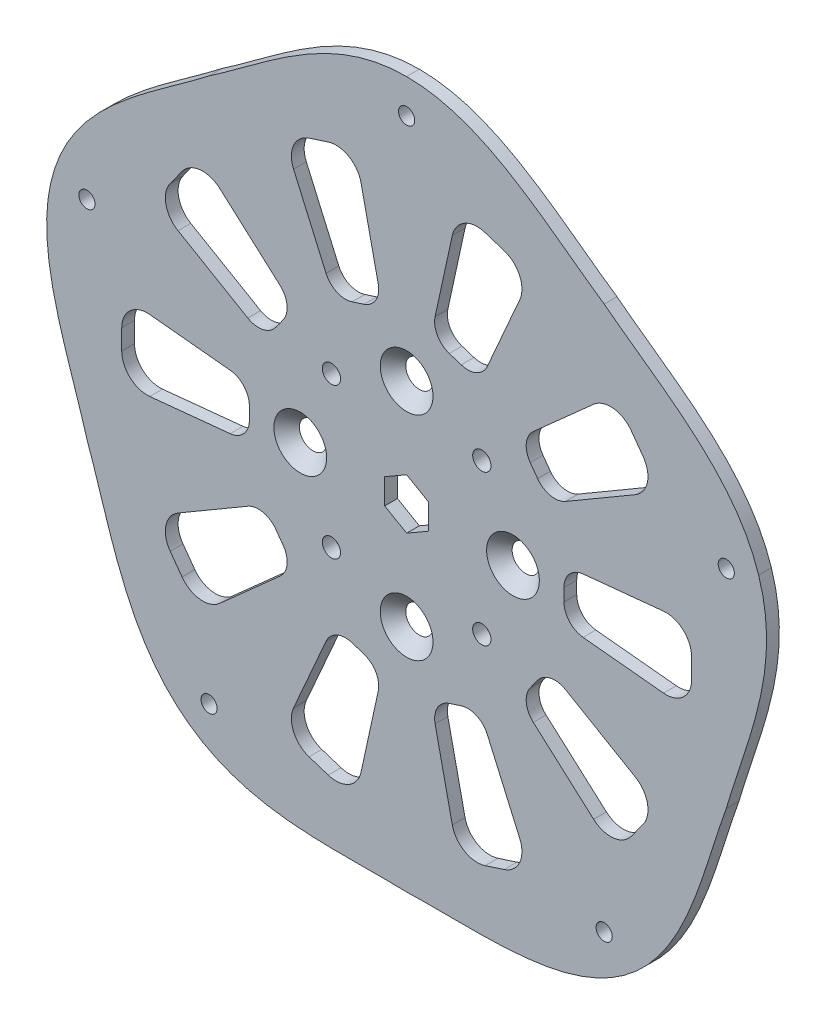
from build123d import *

# Parameters (mm, degrees)
SZKIC1_R                    = 3.3
SZKIC1_R_2                  = 3.2
SZKIC1_R_3                  = 1.9
DODANIE_WYCI_GNI_CIE1_DEPTH = 3
SKETCH1_R                   = 2.15
CUT_EXTRUDE1_DEPTH          = 7
CHAMFER1_SIZE               = 3
CUT_EXTRUDE2_DEPTH          = 5.5


with BuildPart() as part:
    # Szkic1 → Dodanie-wyciągnięcie1 (new body)
    with BuildSketch(Plane.XY):
        with BuildLine():
            add(Edge.make_bspline(
                [(0, 87), (18.224844976, 86.998612649), (32.288902875, 73.536902698), (46.435034931, 63.912342556)],
                knots=[0, 0, 0, 0, 1, 1, 1, 1], degree=3))
            add(Edge.make_bspline(
                [(82.741916918, 26.884478511), (77.108810651, 44.216907368), (59.959930782, 53.43272413), (46.435034931, 63.912342556)],
                knots=[0, 0, 0, 0, 1, 1, 1, 1], degree=3))
            add(Edge.make_bspline(
                [(82.741916918, 26.884478511), (88.372384286, 9.551192223), (79.915570217, -7.984418835), (75.133464787, -24.412342556)],
                knots=[0, 0, 0, 0, 1, 1, 1, 1], degree=3))
            add(Edge.make_bspline(
                [(51.137316949, -70.384478511), (65.88071079, -59.671061018), (69.346178061, -40.513663074), (75.133464787, -24.412342556)],
                knots=[0, 0, 0, 0, 1, 1, 1, 1], degree=3))
            add(Edge.make_bspline(
                [(51.137316949, -70.384478511), (36.39229218, -81.095651222), (17.10163575, -78.471544919), (0, -79)],
                knots=[0, 0, 0, 0, 1, 1, 1, 1], degree=3))
            add(Edge.make_bspline(
                [(-51.137316949, -70.384478511), (-36.39229218, -81.095651222), (-17.10163575, -78.471544919), (0, -79)],
                knots=[0, 0, 0, 0, 1, 1, 1, 1], degree=3))
            add(Edge.make_bspline(
                [(-51.137316949, -70.384478511), (-65.88071079, -59.671061018), (-69.346178061, -40.513663074), (-75.133464787, -24.412342556)],
                knots=[0, 0, 0, 0, 1, 1, 1, 1], degree=3))
            add(Edge.make_bspline(
                [(-82.741916918, 26.884478511), (-88.372384286, 9.551192223), (-79.915570217, -7.984418835), (-75.133464787, -24.412342556)],
                knots=[0, 0, 0, 0, 1, 1, 1, 1], degree=3))
            add(Edge.make_bspline(
                [(-82.741916918, 26.884478511), (-77.108810651, 44.216907368), (-59.959930782, 53.43272413), (-46.435034931, 63.912342556)],
                knots=[0, 0, 0, 0, 1, 1, 1, 1], degree=3))
            add(Edge.make_bspline(
                [(0, 87), (-18.224844976, 86.998612649), (-32.288902875, 73.536902698), (-46.435034931, 63.912342556)],
                knots=[0, 0, 0, 0, 1, 1, 1, 1], degree=3))
        make_face()
        Circle(SZKIC1_R, mode=Mode.SUBTRACT)
        with Locations((0, 25)):
            Circle(SZKIC1_R_2, mode=Mode.SUBTRACT)
        with Locations((0, 79)):
            Circle(SZKIC1_R_3, mode=Mode.SUBTRACT)
        with Locations((25, 0)):
            Circle(SZKIC1_R_2, mode=Mode.SUBTRACT)
        with Locations((0, -25)):
            Circle(SZKIC1_R_2, mode=Mode.SUBTRACT)
        with Locations((-25, 0)):
            Circle(SZKIC1_R_2, mode=Mode.SUBTRACT)
        with Locations((75.133464787, 24.412342556)):
            Circle(SZKIC1_R_3, mode=Mode.SUBTRACT)
        with Locations((46.435034931, -63.912342556)):
            Circle(SZKIC1_R_3, mode=Mode.SUBTRACT)
        with Locations((-46.435034931, -63.912342556)):
            Circle(SZKIC1_R_3, mode=Mode.SUBTRACT)
        with Locations((-75.133464787, 24.412342556)):
            Circle(SZKIC1_R_3, mode=Mode.SUBTRACT)
        with BuildLine():
            Line((10.030761285, 35.644910387), (12.836496299, 34.733271819))
            ThreePointArc((12.836496299, 34.733271819), (16.426794018, 34.925977845), (18.959522589, 37.477969089))
            Line((18.959522589, 37.477969089), (26.597641156, 54.869351783))
            ThreePointArc((26.597641156, 54.869351783), (26.579203441, 59.736309453), (22.958213542, 62.988393254))
            Line((22.958213542, 62.988393254), (18.450063705, 64.45317993))
            ThreePointArc((18.450063705, 64.45317993), (13.609094442, 63.950553329), (10.733452075, 60.02393928))
            Line((10.733452075, 60.02393928), (6.690421537, 41.464441676))
            ThreePointArc((6.690421537, 41.464441676), (7.239419176, 37.911136888), (10.030761285, 35.644910387))
        make_face(mode=Mode.SUBTRACT)
        with BuildLine():
            Line((29.052350399, 22.952658594), (30.786390001, 20.565957836))
            ThreePointArc((30.786390001, 20.565957836), (33.804271631, 18.611536236), (37.353314904, 19.18744002))
            Line((37.353314904, 19.18744002), (53.755080895, 28.767790725))
            ThreePointArc((53.755080895, 28.767790725), (56.600890412, 32.716079608), (55.582974944, 37.475435132))
            Line((55.582974944, 37.475435132), (52.796785118, 41.310296435))
            ThreePointArc((52.796785118, 41.310296435), (48.584922212, 43.749113313), (43.950472839, 42.262675991))
            Line((43.950472839, 42.262675991), (29.770593443, 29.624160747))
            ThreePointArc((29.770593443, 29.624160747), (28.126161711, 26.426784072), (29.052350399, 22.952658594))
        make_face(mode=Mode.SUBTRACT)
        with BuildLine():
            Line((36.98082083, 1.50380164), (36.98082083, -1.446322739))
            ThreePointArc((36.98082083, -1.446322739), (38.273558162, -4.801349343), (41.483302234, -6.42150869))
            Line((41.483302234, -6.42150869), (60.383798515, -8.311558318))
            ThreePointArc((60.383798515, -8.311558318), (65.006852754, -6.790050378), (66.98082083, -2.341335177))
            Line((66.98082083, -2.341335177), (66.98082083, 2.398814078))
            ThreePointArc((66.98082083, 2.398814078), (65.006852754, 6.847529279), (60.383798515, 8.369037219))
            Line((60.383798515, 8.369037219), (41.483302234, 6.478987591))
            ThreePointArc((41.483302234, 6.478987591), (38.273558162, 4.858828243), (36.98082083, 1.50380164))
        make_face(mode=Mode.SUBTRACT)
        with BuildLine():
            Line((30.787766351, -20.508926139), (29.053726749, -22.895626897))
            ThreePointArc((29.053726749, -22.895626897), (28.127538061, -26.369752375), (29.771969793, -29.56712905))
            Line((29.771969793, -29.56712905), (43.951849189, -42.205644294))
            ThreePointArc((43.951849189, -42.205644294), (48.586298562, -43.692081616), (52.798161469, -41.253264738))
            Line((52.798161469, -41.253264738), (55.584351294, -37.418403435))
            ThreePointArc((55.584351294, -37.418403435), (56.602266762, -32.659047911), (53.756457245, -28.710759028))
            Line((53.756457245, -28.710759028), (37.354691254, -19.130408323))
            ThreePointArc((37.354691254, -19.130408323), (33.805647981, -18.554504539), (30.787766351, -20.508926139))
        make_face(mode=Mode.SUBTRACT)
        with BuildLine():
            Line((12.83872328, -34.677410915), (10.032988266, -35.589049483))
            ThreePointArc((10.032988266, -35.589049483), (7.241646157, -37.855275984), (6.692648518, -41.408580772))
            Line((6.692648518, -41.408580772), (10.735679056, -59.968078377))
            ThreePointArc((10.735679056, -59.968078377), (13.611321423, -63.894692425), (18.452290686, -64.397319026))
            Line((18.452290686, -64.397319026), (22.960440523, -62.93253235))
            ThreePointArc((22.960440523, -62.93253235), (26.581430423, -59.680448549), (26.599868138, -54.813490879))
            Line((26.599868138, -54.813490879), (18.96174957, -37.422108185))
            ThreePointArc((18.96174957, -37.422108185), (16.429020999, -34.870116941), (12.83872328, -34.677410915))
        make_face(mode=Mode.SUBTRACT)
        with BuildLine():
            Line((-10.010383995, -35.589773073), (-12.81611901, -34.678134505))
            ThreePointArc((-12.81611901, -34.678134505), (-16.406416729, -34.870840531), (-18.939145299, -37.422831775))
            Line((-18.939145299, -37.422831775), (-26.577263867, -54.814214469))
            ThreePointArc((-26.577263867, -54.814214469), (-26.558826152, -59.681172139), (-22.937836252, -62.93325594))
            Line((-22.937836252, -62.93325594), (-18.429686416, -64.398042616))
            ThreePointArc((-18.429686416, -64.398042616), (-13.588717152, -63.895416015), (-10.713074786, -59.968801967))
            Line((-10.713074786, -59.968801967), (-6.670044248, -41.409304362))
            ThreePointArc((-6.670044248, -41.409304362), (-7.219041887, -37.855999574), (-10.010383995, -35.589773073))
        make_face(mode=Mode.SUBTRACT)
        with BuildLine():
            Line((-29.03197311, -22.89752128), (-30.766012712, -20.510820522))
            ThreePointArc((-30.766012712, -20.510820522), (-33.783894342, -18.556398922), (-37.332937615, -19.132302706))
            Line((-37.332937615, -19.132302706), (-53.734703606, -28.712653412))
            ThreePointArc((-53.734703606, -28.712653412), (-56.580513122, -32.660942294), (-55.562597655, -37.420297818))
            Line((-55.562597655, -37.420297818), (-52.776407829, -41.255159121))
            ThreePointArc((-52.776407829, -41.255159121), (-48.564544923, -43.693975999), (-43.930095549, -42.207538678))
            Line((-43.930095549, -42.207538678), (-29.750216154, -29.569023433))
            ThreePointArc((-29.750216154, -29.569023433), (-28.105784422, -26.371646758), (-29.03197311, -22.89752128))
        make_face(mode=Mode.SUBTRACT)
        with BuildLine():
            Line((-36.96044354, -1.448664326), (-36.96044354, 1.501460053))
            ThreePointArc((-36.96044354, 1.501460053), (-38.253180873, 4.856486657), (-41.462924945, 6.476646004))
            Line((-41.462924945, 6.476646004), (-60.363421226, 8.366695632))
            ThreePointArc((-60.363421226, 8.366695632), (-64.986475465, 6.845187692), (-66.96044354, 2.396472491))
            Line((-66.96044354, 2.396472491), (-66.96044354, -2.343676764))
            ThreePointArc((-66.96044354, -2.343676764), (-64.986475465, -6.792391965), (-60.363421226, -8.313899905))
            Line((-60.363421226, -8.313899905), (-41.462924945, -6.423850277))
            ThreePointArc((-41.462924945, -6.423850277), (-38.253180873, -4.80369093), (-36.96044354, -1.448664326))
        make_face(mode=Mode.SUBTRACT)
        with BuildLine():
            Line((-30.767389062, 20.564063452), (-29.03334946, 22.95076421))
            ThreePointArc((-29.03334946, 22.95076421), (-28.107160772, 26.424889688), (-29.751592504, 29.622266363))
            Line((-29.751592504, 29.622266363), (-43.9314719, 42.260781608))
            ThreePointArc((-43.9314719, 42.260781608), (-48.565921273, 43.747218929), (-52.777784179, 41.308402052))
            Line((-52.777784179, 41.308402052), (-55.563974005, 37.473540749))
            ThreePointArc((-55.563974005, 37.473540749), (-56.581889472, 32.714185224), (-53.736079956, 28.765896342))
            Line((-53.736079956, 28.765896342), (-37.334313965, 19.185545636))
            ThreePointArc((-37.334313965, 19.185545636), (-33.785270692, 18.609641852), (-30.767389062, 20.564063452))
        make_face(mode=Mode.SUBTRACT)
        with BuildLine():
            Line((-12.818345991, 34.732548229), (-10.012610977, 35.644186797))
            ThreePointArc((-10.012610977, 35.644186797), (-7.221268868, 37.910413298), (-6.672271229, 41.463718086))
            Line((-6.672271229, 41.463718086), (-10.715301767, 60.02321569))
            ThreePointArc((-10.715301767, 60.02321569), (-13.590944134, 63.949829739), (-18.431913397, 64.452456339))
            Line((-18.431913397, 64.452456339), (-22.940063234, 62.987669664))
            ThreePointArc((-22.940063234, 62.987669664), (-26.561053133, 59.735585862), (-26.579490849, 54.868628193))
            Line((-26.579490849, 54.868628193), (-18.941372281, 37.477245499))
            ThreePointArc((-18.941372281, 37.477245499), (-16.40864371, 34.925254255), (-12.818345991, 34.732548229))
        make_face(mode=Mode.SUBTRACT)
    extrude(amount=DODANIE_WYCI_GNI_CIE1_DEPTH)

    # Sketch1 → Cut-Extrude1 (cut)
    with BuildSketch(Plane(origin=(0, 0, 0), x_dir=(-1, 0, 0), z_dir=(0, 0, -1))):
        with Locations((-17.67766953, 17.67766953)):
            Circle(SKETCH1_R)
        with Locations((17.67766953, 17.67766953)):
            Circle(SKETCH1_R)
        with Locations((17.67766953, -17.67766953)):
            Circle(SKETCH1_R)
        with Locations((-17.67766953, -17.67766953)):
            Circle(SKETCH1_R)
    extrude(amount=-CUT_EXTRUDE1_DEPTH, mode=Mode.SUBTRACT)

    # Chamfer1
    chamfer1_edges = [part.edges().sort_by_distance(p)[0] for p in [
        (-3.2, 25, 3),
        (21.8, 0, 3),
        (-3.2, -25, 3),
        (-28.2, 0, 3),
    ]]
    chamfer(chamfer1_edges, length=CHAMFER1_SIZE - 0.0001)  # a hair under: the kernel refuses the full size

    # Sketch2 → Cut-Extrude2 (cut)
    with BuildSketch(Plane.XY.offset(3)):
        Polygon((-5.15, 2.973353886), (-5.15, -2.973353886), (0, -5.946707773), (5.15, -2.973353886), (5.15, 2.973353886), (0, 5.946707773), align=None)
    extrude(amount=-CUT_EXTRUDE2_DEPTH, mode=Mode.SUBTRACT)


solid = part.part
